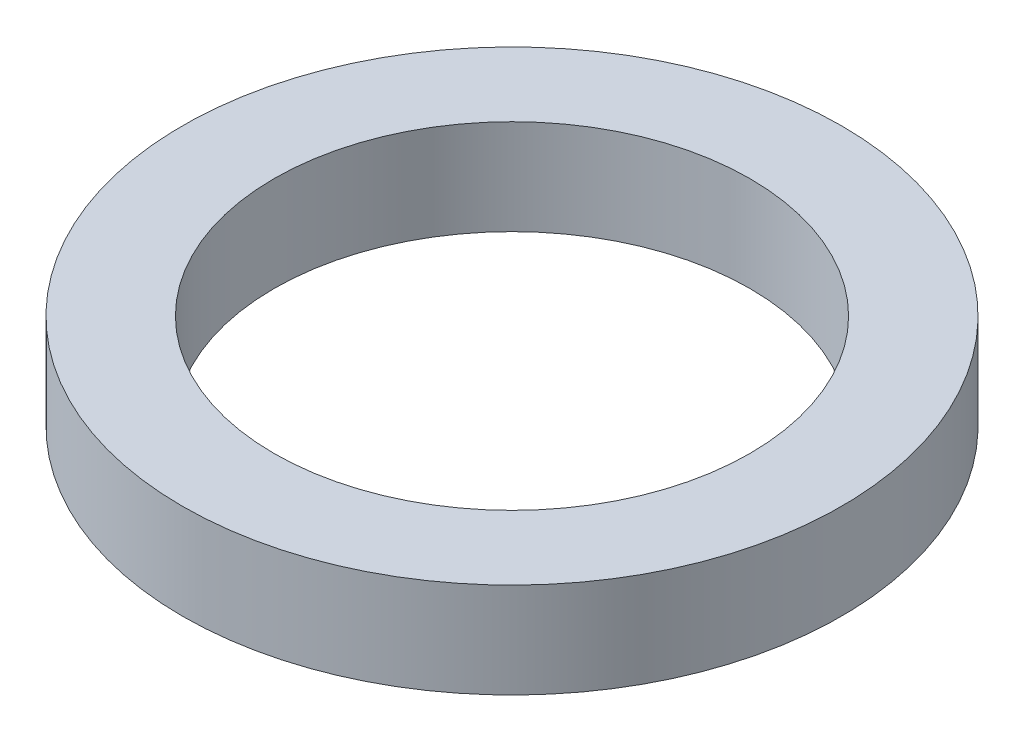
from build123d import *

# Parameters (mm, degrees)
SKETCH1_R           = 45
BOSS_EXTRUDE1_DEPTH = 13
SKETCH2_R           = 32.5
CUT_EXTRUDE1_DEPTH  = 65.953829756


with BuildPart() as part:
    # Sketch1 → Boss-Extrude1 (new body)
    with BuildSketch(Plane(origin=(0, 0, 0), x_dir=(1, 0, 0), z_dir=(0, 1, 0))):
        Circle(SKETCH1_R)
    extrude(amount=BOSS_EXTRUDE1_DEPTH)

    # Sketch2 → Cut-Extrude1 (cut, through all)
    with BuildSketch(Plane(origin=(0, 0, 0), x_dir=(1, 0, 0), z_dir=(0, 1, 0))):
        Circle(SKETCH2_R)
    extrude(amount=CUT_EXTRUDE1_DEPTH, mode=Mode.SUBTRACT)


solid = part.part
